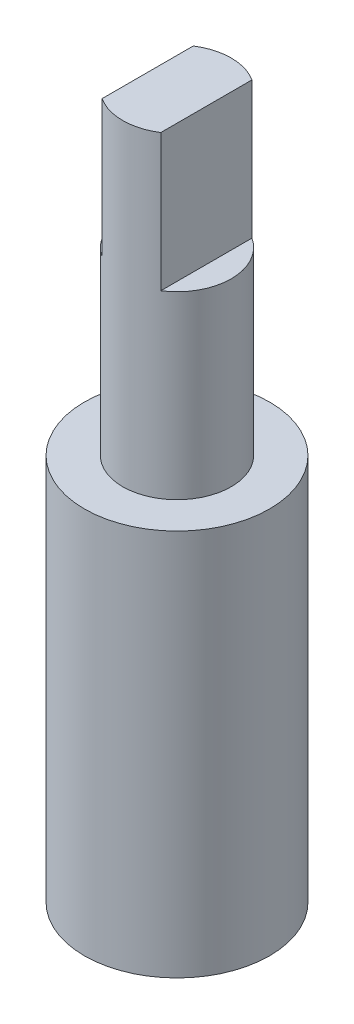
from build123d import *

# Parameters (mm, degrees)
SKETCH1_R           = 3.075
BOSS_EXTRUDE1_DEPTH = 12.85
SKETCH2_R           = 1.8
BOSS_EXTRUDE2_DEPTH = 5.98
BOSS_EXTRUDE3_DEPTH = 4.55
SKETCH4_R           = 2.15
CUT_EXTRUDE1_DEPTH  = 1.95


with BuildPart() as part:
    # Sketch1 → Boss-Extrude1 (new body)
    with BuildSketch(Plane(origin=(0, 0, 0), x_dir=(1, 0, 0), z_dir=(0, 1, 0))):
        Circle(SKETCH1_R)
    extrude(amount=BOSS_EXTRUDE1_DEPTH)

    # Sketch2 → Boss-Extrude2 (add)
    with BuildSketch(Plane(origin=(0, 12.85, 0), x_dir=(1, 0, 0), z_dir=(0, 1, 0))):
        Circle(SKETCH2_R)
    extrude(amount=BOSS_EXTRUDE2_DEPTH)

    # Sketch3 → Boss-Extrude3 (add)
    with BuildSketch(Plane(origin=(0, 18.83, 0), x_dir=(1, 0, 0), z_dir=(0, 1, 0))):
        with BuildLine():
            Line((-0.975, 1.513068075), (-0.975, -1.513068075))
            ThreePointArc((-0.975, -1.513068075), (0, -1.8), (0.975, -1.513068075))
            Line((0.975, -1.513068075), (0.975, 1.513068075))
            ThreePointArc((0.975, 1.513068075), (0, 1.8), (-0.975, 1.513068075))
        make_face()
    extrude(amount=BOSS_EXTRUDE3_DEPTH)

    # Sketch4 → Cut-Extrude1 (cut)
    with BuildSketch(Plane.XZ):
        Circle(SKETCH4_R)
    extrude(amount=-CUT_EXTRUDE1_DEPTH, mode=Mode.SUBTRACT)


solid = part.part
